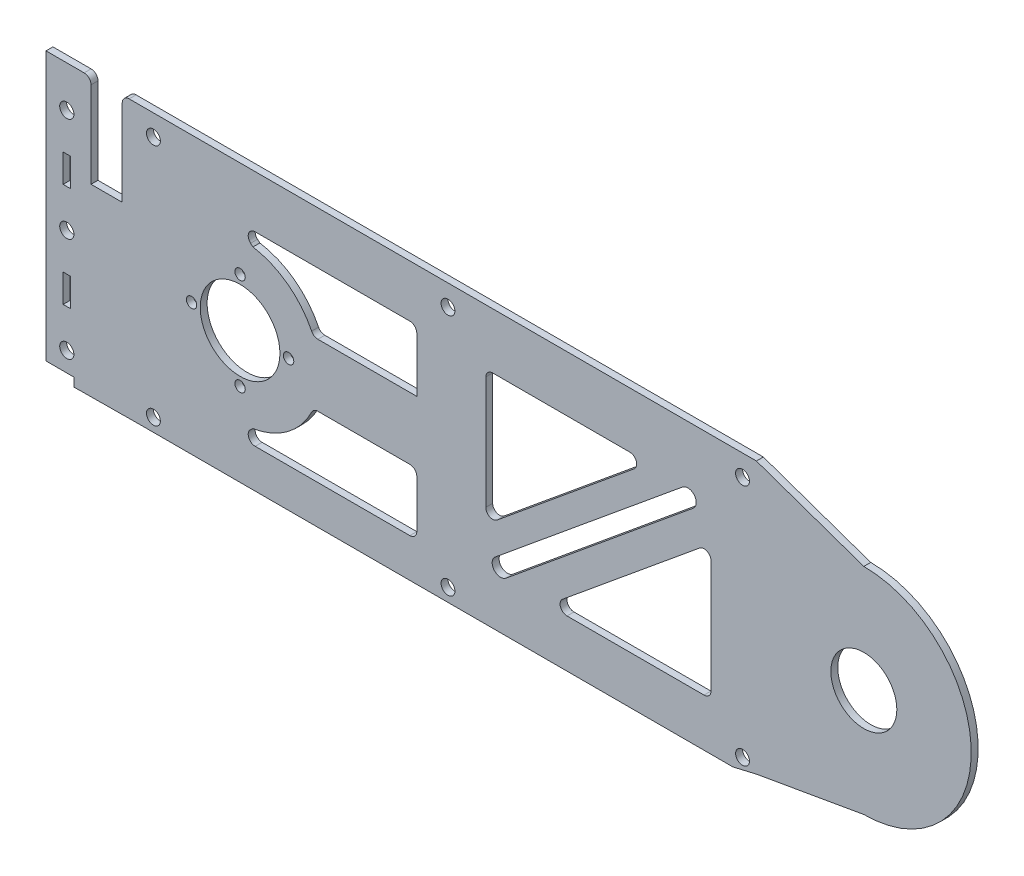
from build123d import *

# Parameters (mm, degrees)
SKETCH_1_R          = 2.05
SKETCH_1_W          = 2.1
SKETCH_1_H          = 8.1
SKETCH_1_R_2        = 1.5
SKETCH_1_R_3        = 11.5
SKETCH_1_R_4        = 9.525
EXTRUDE_1_DEPTH     = 2
SKETCH_2_R          = 2
CUT_EXTRUDE_1_DEPTH = 4
FILLET_1_R          = 2


with BuildPart() as part:
    # 草图1 → 凸台-拉伸1 (new body)
    with BuildSketch(Plane.XY):
        with BuildLine():
            Line((-4.357142857, 41.804285714), (-4.357142857, -0.045714286))
            Line((-4.357142857, -0.045714286), (-4.357142857, -35.702553436))
            Line((-4.357142857, -35.702553436), (3.792857143, -35.702553436))
            Line((3.792857143, -35.702553436), (3.792857143, -38.195714286))
            Line((3.792857143, -38.195714286), (22.465844759, -38.045714286))
            Line((22.465844759, -38.045714286), (193.846868021, -38.045714286))
            Line((193.846868021, -38.045714286), (200.656073527, -36.45591431))
            Line((200.656073527, -36.45591431), (231.642857143, -31.045714286))
            ThreePointArc((231.642857143, -31.045714286), (262.642857143, -0.045714286), (231.642857143, 30.954285714))
            Line((231.642857143, 30.954285714), (200.642857143, 41.804285714))
            Line((200.642857143, 41.804285714), (17.642857143, 41.804285714))
            Line((17.642857143, 41.804285714), (17.642857143, 14.954285714))
            Line((17.642857143, 14.954285714), (8.642857143, 14.954285714))
            Line((8.642857143, 14.954285714), (8.642857143, 41.804285714))
            Line((8.642857143, 41.804285714), (-4.357142857, 41.804285714))
        make_face()
        with Locations((1.642857143, -30.045714286)):
            Circle(SKETCH_1_R, mode=Mode.SUBTRACT)
        with Locations((1.642857143, -15.045714286)):
            Rectangle(SKETCH_1_W, SKETCH_1_H, mode=Mode.SUBTRACT)
        with Locations((51.642857143, -14.045714286)):
            Circle(SKETCH_1_R_2, mode=Mode.SUBTRACT)
        with Locations((1.642857143, -0.045714286)):
            Circle(SKETCH_1_R, mode=Mode.SUBTRACT)
        with Locations((37.642857143, -0.045714286)):
            Circle(SKETCH_1_R_2, mode=Mode.SUBTRACT)
        with Locations((51.642857143, -0.045714286)):
            Circle(SKETCH_1_R_3, mode=Mode.SUBTRACT)
        with Locations((65.642857143, -0.045714286)):
            Circle(SKETCH_1_R_2, mode=Mode.SUBTRACT)
        with Locations((231.642857143, -0.045714286)):
            Circle(SKETCH_1_R_4, mode=Mode.SUBTRACT)
        with Locations((1.642857143, 14.954285714)):
            Rectangle(SKETCH_1_W, SKETCH_1_H, mode=Mode.SUBTRACT)
        with Locations((51.642857143, 13.954285714)):
            Circle(SKETCH_1_R_2, mode=Mode.SUBTRACT)
        with BuildLine():
            ThreePointArc((1.642857143, 27.904285714), (-0.407142857, 29.954285714), (1.642857143, 32.004285714))
            ThreePointArc((1.642857143, 32.004285714), (3.092426044, 31.403854616), (3.692857143, 29.954285714))
            ThreePointArc((3.692857143, 29.954285714), (3.092426044, 28.504716813), (1.642857143, 27.904285714))
        make_face(mode=Mode.SUBTRACT)
    extrude(amount=EXTRUDE_1_DEPTH)

    # 草图2 → 切除-拉伸1 (cut)
    with BuildSketch(Plane.XY.offset(2)):
        with Locations((26.642857143, 35.754285714)):
            Circle(SKETCH_2_R)
        with Locations((111.642857143, 35.754285714)):
            Circle(SKETCH_2_R)
        with Locations((196.642857143, 35.754285714)):
            Circle(SKETCH_2_R)
        with Locations((111.642857143, -34.245714286)):
            Circle(SKETCH_2_R)
        with Locations((196.642857143, -34.245714286)):
            Circle(SKETCH_2_R)
        with Locations((26.642857143, -34.245714286)):
            Circle(SKETCH_2_R)
        Polygon((187.542857143, -24.245714286), (140.41622539, -24.245714286), (187.542857143, 14.56445304), align=None)
        Polygon((122.542857143, 25.754285714), (169.669488896, 25.754285714), (122.542857143, -13.055881612), align=None)
        with BuildLine():
            Line((72.808867631, 8.954285714), (102.642857143, 8.954285714))
            Line((102.642857143, 8.954285714), (102.642857143, 26.754285714))
            Line((102.642857143, 26.754285714), (50.657939371, 26.754285714))
            Line((50.657939371, 26.754285714), (55.363054959, 22.651424922))
            ThreePointArc((55.363054959, 22.651424922), (65.846157695, 18.044787461), (72.808867631, 8.954285714))
        make_face()
        with BuildLine():
            Line((102.642857143, -9.045714286), (102.642857143, -26.845714286))
            Line((102.642857143, -26.845714286), (50.657939371, -26.845714286))
            Line((50.657939371, -26.845714286), (55.363054959, -22.742853493))
            ThreePointArc((55.363054959, -22.742853493), (65.846157695, -18.136216032), (72.808867631, -9.045714286))
            Line((72.808867631, -9.045714286), (102.642857143, -9.045714286))
        make_face()
        with BuildLine():
            Line((125.279005787, -19.870759717), (179.314122281, 24.628747983))
            ThreePointArc((179.314122281, 24.628747983), (182.731673921, 24.298017179), (182.400943117, 20.880465538))
            Line((182.400943117, 20.880465538), (128.365826624, -23.619042162))
            ThreePointArc((128.365826624, -23.619042162), (124.948274984, -23.288311358), (125.279005787, -19.870759717))
        make_face()
    extrude(amount=-CUT_EXTRUDE_1_DEPTH, mode=Mode.SUBTRACT)

    # 圆角1
    fillet_1_edges = [part.edges().sort_by_distance(p)[0] for p in [
        (187.542857143, -24.245714286, 1),
        (140.41622539, -24.245714286, 1),
        (187.542857143, 14.56445304, 1),
        (169.669488896, 25.754285714, 1),
        (122.542857143, -13.055881612, 1),
        (122.542857143, 25.754285714, 1),
        (72.808867631, 8.954285714, 1),
        (72.808867631, -9.045714286, 1),
        (50.657939371, -26.845714286, 1),
        (102.642857143, -26.845714286, 1),
        (50.657939371, 26.754285714, 1),
        (102.642857143, 26.754285714, 1),
        (102.642857143, -9.045714286, 1),
        (17.642857143, 41.804285714, 1),
        (8.642857143, 41.804285714, 1),
    ]]
    fillet(fillet_1_edges, radius=FILLET_1_R)


solid = part.part
